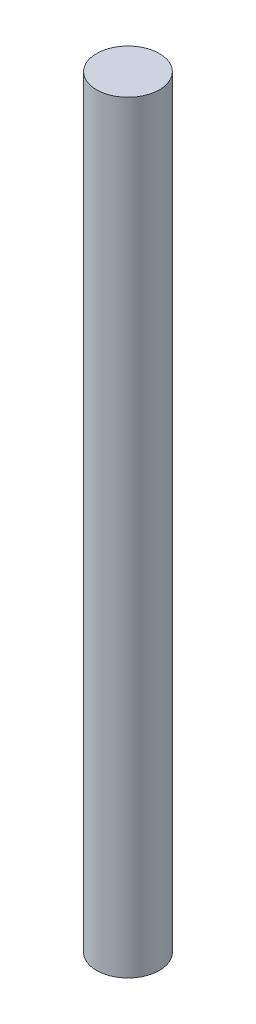
from build123d import *

# Parameters (mm, degrees)
ELEVATION_BAR_R          = 30.226
ELEVATION_BAR_PART_DEPTH = 734.06


with BuildPart() as part:
    # Elevation Bar → Elevation Bar Part (new body)
    with BuildSketch(Plane(origin=(0, 0, 0), x_dir=(1, 0, 0), z_dir=(0, 1, 0))):
        Circle(ELEVATION_BAR_R)
    extrude(amount=ELEVATION_BAR_PART_DEPTH)


solid = part.part
